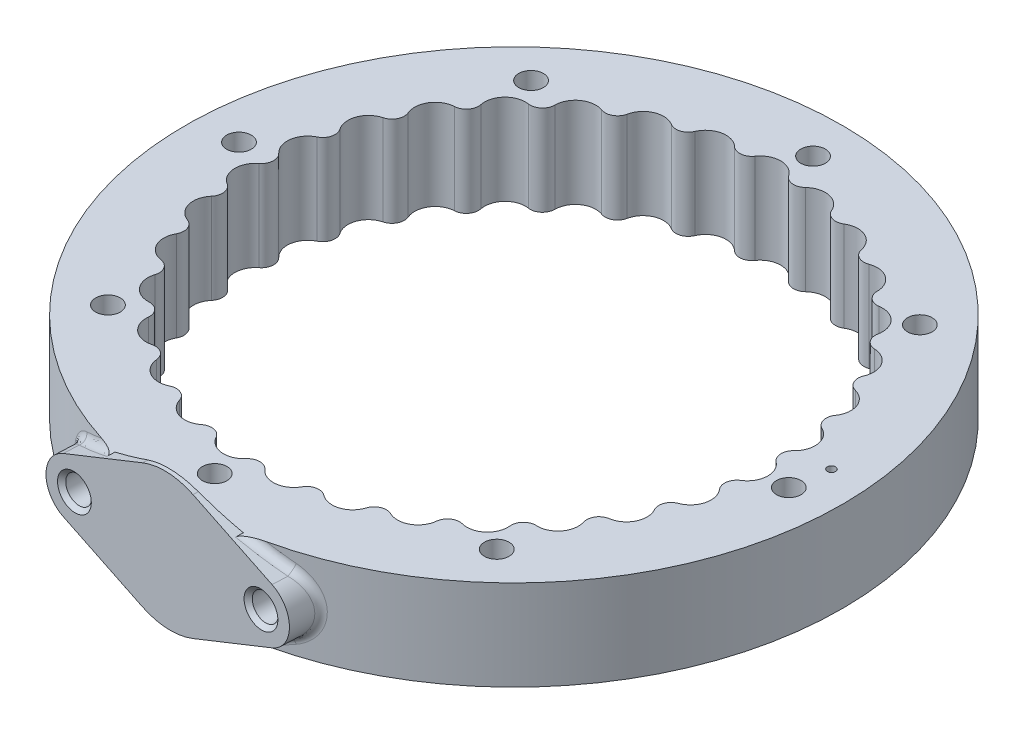
from build123d import *

# Parameters (mm, degrees)
SKETCH1_R                = 80
BOSS_EXTRUDE1_DEPTH      = 22
FILLET1_R                = 2.5
FILLET2_R                = 3
SKETCH3_R                = 3.000000000000008
SKETCH3_R_2              = 3.0000000000000084
SKETCH3_R_3              = 3.00000000000001
SKETCH3_R_4              = 3.0000000000000018
SKETCH3_R_5              = 3.000000000000013
CUT_EXTRUDE1_DEPTH       = 116.2562364317003
SKETCH5_R                = 0.9999999999999983
CUT_EXTRUDE3_DEPTH       = 2
BOSS_EXTRUDE2_REACH      = 184.594
BOSS_EXTRUDE2_END_RADIUS = 80
SKETCH7_R                = 3.300000000000001
CUT_EXTRUDE4_DEPTH       = 10.5
CHAMFER1_SIZE            = 1
FILLET3_R                = 2


with BuildPart() as part:
    # Sketch1 → Boss-Extrude1 (new body)
    with BuildSketch(Plane(origin=(0, 0, 0), x_dir=(1, 0, 0), z_dir=(0, 1, 0))):
        with Locations(Location((0, 0, 0), (0, 0, 270))):
            Circle(SKETCH1_R)
        with BuildLine():
            ThreePointArc((-38.25733201142191, 46.220953553208226), (-39.08234896333278, 45.52548736156793), (-39.894725747841804, 44.81529713729997))
            ThreePointArc((-39.894725747841804, 44.81529713729997), (-47.11153116989224, 44.78284973992021), (-46.77841172497277, 37.57366360216861))
            ThreePointArc((-46.77841172497277, 37.57366360216861), (-47.44654421626143, 36.726358952860394), (-48.09933135913986, 35.86717611972908))
            ThreePointArc((-48.09933135913986, 35.86717611972908), (-55.161876737158465, 34.38266067125329), (-53.38437776627331, 27.38810344853807))
            ThreePointArc((-53.38437776627331, 27.38810344853807), (-53.86827237424419, 26.423649093458668), (-54.33474469316336, 25.45064869760212))
            ThreePointArc((-54.33474469316336, 25.45064869760212), (-60.95388858956005, 22.574841434914035), (-57.80478110942453, 16.081271121758906))
            ThreePointArc((-57.80478110942453, 16.081271121758906), (-58.0846271319721, 15.039151935523844), (-58.345687195387306, 13.99216872747105))
            ThreePointArc((-58.345687195387306, 13.99216872747105), (-64.25044108132712, 9.842805537798224), (-59.85864992218248, 4.116069665785945))
            ThreePointArc((-59.85864992218248, 4.116069665785945), (-59.922990430263134, 3.038950130323448), (-59.96795040850489, 1.9608477256273142))
            ThreePointArc((-59.96795040850489, 1.9608477256273142), (-64.91657296611908, -3.292195974516327), (-59.46189857403357, -8.017644165922082))
            ThreePointArc((-59.46189857403357, -8.017644165922082), (-59.30809945968678, -9.085666650273934), (-59.1351186859633, -10.15075061249335))
            ThreePointArc((-59.1351186859633, -10.15075061249335), (-62.925012726303535, -16.29241459681624), (-56.63077011178724, -19.823114703444162))
            ThreePointArc((-56.63077011178724, -19.823114703444162), (-56.26512792882501, -20.838315170688706), (-55.881288256336916, -21.8467760278761))
            ThreePointArc((-55.881288256336916, -21.8467760278761), (-58.35729507209849, -28.625619851245656), (-51.481171267331455, -30.81702459588994))
            ThreePointArc((-51.481171267331455, -30.81702459588994), (-50.91865544968535, -31.73784061961726), (-50.3396713197235, -32.64839186579035))
            ThreePointArc((-50.3396713197235, -32.64839186579035), (-51.40042290095079, -39.786888865597625), (-44.223927222410275, -40.54928188053345))
            ThreePointArc((-44.223927222410275, -40.54928188053345), (-43.487567233747555, -41.33801514454081), (-42.73714232462038, -42.113378704695975))
            ThreePointArc((-42.73714232462038, -42.113378704695975), (-42.33921137694489, -49.31927797503106), (-35.15615040091281, -48.621446800649586))
            ThreePointArc((-35.15615040091281, -48.621446800649586), (-34.27609290568797, -49.245806472436286), (-33.384949701346294, -49.85423887131944))
            ThreePointArc((-33.384949701346294, -49.85423887131944), (-31.54462756452073, -56.83253004939758), (-24.649076651329672, -54.70304397596968))
            ThreePointArc((-24.649076651329672, -54.70304397596968), (-23.66135130679959, -55.13746869721361), (-22.66597331473413, -55.55406064092668))
            ThreePointArc((-22.66597331473413, -55.55406064092668), (-19.45860299326879, -62.01905166600311), (-13.132866807497502, -58.54509210357883))
            ThreePointArc((-13.132866807497502, -58.54509210357883), (-12.077911205320014, -58.77179647514957), (-11.019049317477785, -58.97949264056949))
            ThreePointArc((-11.019049317477785, -58.97949264056949), (-6.575940929183566, -64.66650602047315), (-1.0789958535201936, -59.99029728171117))
            ThreePointArc((-1.0789958535201936, -59.99029728171117), (-4.7594e-13, -59.99999999999997), (1.0789958535192405, -59.99029728171119))
            ThreePointArc((1.0789958535192405, -59.99029728171119), (6.575940929182646, -64.66650602047334), (11.019049317477018, -58.97949264056963))
            ThreePointArc((11.019049317477018, -58.97949264056963), (12.077911205319237, -58.77179647514973), (13.132866807496727, -58.545092103578995))
            ThreePointArc((13.132866807496727, -58.545092103578995), (19.458602993267856, -62.019051666003314), (22.665973314733233, -55.55406064092704))
            ThreePointArc((22.665973314733233, -55.55406064092704), (23.661351306798718, -55.137468697214), (24.6490766513288, -54.70304397597007))
            ThreePointArc((24.6490766513288, -54.70304397597007), (31.54462756451996, -56.832530049398116), (33.38494970134564, -49.854238871319865))
            ThreePointArc((33.38494970134564, -49.854238871319865), (34.27609290568728, -49.245806472436755), (35.1561504009121, -48.62144680065009))
            ThreePointArc((35.1561504009121, -48.62144680065009), (42.33921137694416, -49.31927797503165), (42.737142324619775, -42.113378704696586))
            ThreePointArc((42.737142324619775, -42.113378704696586), (43.48756723374697, -41.33801514454142), (44.223927222409706, -40.549281880534075))
            ThreePointArc((44.223927222409706, -40.549281880534075), (51.400422900950204, -39.78688886559833), (50.339671319723045, -32.64839186579106))
            ThreePointArc((50.339671319723045, -32.64839186579106), (50.918655449684906, -31.73784061961798), (51.481171267331014, -30.817024595890675))
            ThreePointArc((51.481171267331014, -30.817024595890675), (58.35729507209809, -28.625619851246487), (55.88128825633658, -21.846776027876892))
            ThreePointArc((55.88128825633658, -21.846776027876892), (56.26512792882472, -20.838315170689455), (56.63077011178698, -19.823114703444876))
            ThreePointArc((56.63077011178698, -19.823114703444876), (62.925012726303216, -16.292414596817103), (59.13511868596313, -10.15075061249427))
            ThreePointArc((59.13511868596313, -10.15075061249427), (59.30809945968664, -9.085666650274833), (59.46189857403344, -8.017644165922947))
            ThreePointArc((59.46189857403344, -8.017644165922947), (64.91657296611842, -3.2921959745165603), (59.9679504085049, 1.9608477256264434))
            ThreePointArc((59.9679504085049, 1.9608477256264434), (59.922990430263155, 3.0389501303225575), (59.85864992218252, 4.116069665785066))
            ThreePointArc((59.85864992218252, 4.116069665785066), (64.25044108132727, 9.842805537797286), (58.345687195387484, 13.992168727470187))
            ThreePointArc((58.345687195387484, 13.992168727470187), (58.0846271319723, 15.039151935523012), (57.80478110942474, 16.081271121758082))
            ThreePointArc((57.80478110942474, 16.081271121758082), (60.95388858956038, 22.57484143491317), (54.33474469316371, 25.45064869760134))
            ThreePointArc((54.33474469316371, 25.45064869760134), (53.86827237424453, 26.423649093457957), (53.38437776627365, 27.38810344853738))
            ThreePointArc((53.38437776627365, 27.38810344853738), (55.16187673715889, 34.38266067125244), (48.09933135914042, 35.86717611972831))
            ThreePointArc((48.09933135914042, 35.86717611972831), (47.446544216262005, 36.726358952859634), (46.778411724973346, 37.573663602167855))
            ThreePointArc((46.778411724973346, 37.573663602167855), (47.11153116989295, 44.78284973991959), (39.894725747842365, 44.81529713729946))
            ThreePointArc((39.894725747842365, 44.81529713729946), (39.08234896333339, 45.52548736156738), (38.25733201142257, 46.22095355320766))
            ThreePointArc((38.25733201142257, 46.22095355320766), (37.13243398116162, 53.34962367847298), (30.056825376996436, 51.92867462449567))
            ThreePointArc((30.056825376996436, 51.92867462449567), (29.118117751864872, 52.46079696867489), (28.16999263027844, 52.97595223504771))
            ThreePointArc((28.16999263027844, 52.97595223504771), (25.633130582365766, 59.73225775531498), (18.988395043689327, 56.916086071204795))
            ThreePointArc((18.988395043689327, 56.916086071204795), (17.961787378401546, 57.24835538400289), (16.929370441017248, 57.56210920797473))
            ThreePointArc((16.929370441017248, 57.56210920797473), (13.084403805762948, 63.66944618141221), (7.14257758625173, 59.573346266802666))
            ThreePointArc((7.14257758625173, 59.573346266802666), (6.070099319245904, 59.69215940351368), (4.9956578367840825, 59.79166666666665))
            ThreePointArc((4.9956578367840825, 59.79166666666665), (3.1e-16, 65), (-4.9956578367840825, 59.79166666666665))
            ThreePointArc((-4.9956578367840825, 59.79166666666665), (-6.070099319245474, 59.69215940351374), (-7.1425775862508685, 59.57334626680277))
            ThreePointArc((-7.1425775862508685, 59.57334626680277), (-13.08440380576203, 63.66944618141241), (-16.929370441016417, 57.56210920797498))
            ThreePointArc((-16.929370441016417, 57.56210920797498), (-17.96178737840073, 57.24835538400315), (-18.988395043688527, 56.91608607120505))
            ThreePointArc((-18.988395043688527, 56.91608607120505), (-25.633130582364917, 59.73225775531533), (-28.169992630277697, 52.975952235048105))
            ThreePointArc((-28.169992630277697, 52.975952235048105), (-29.118117751864123, 52.46079696867532), (-30.056825376995683, 51.928674624496125))
            ThreePointArc((-30.056825376995683, 51.928674624496125), (-37.132433981160844, 53.349623678473534), (-38.25733201142191, 46.220953553208226))
        make_face(mode=Mode.SUBTRACT)
    extrude(amount=BOSS_EXTRUDE1_DEPTH)

    # Fillet1
    # the kernel refuses this fillet: 2.5 mm, written as the material it takes off along each edge
    with BuildSketch(Plane(origin=(44.2239272224097, -4.826317104519436, 40.549281880534075), x_dir=(0.8583145747701298, 0, 0.5131238551628362), z_dir=(0, 1, 0))) as fillet1_piece_1:
        with BuildLine():
            CenterArc((2.0109654602164038, -2.46743606132209), FILLET1_R, 99.25781783821463, 67.25275199155593)
            ThreePointArc((-0.42006696343993455, -1.8842711145603852), (-0.20245458304721137, -0.9438251469189064), (0, 0))
            ThreePointArc((0, 0), (0.8043861840865579, -0.06512787735582339), (1.6087723681731287, -5e-17))
        make_face()
    extrude(amount=31.652634209038876, mode=Mode.SUBTRACT)
    with BuildSketch(Plane(origin=(42.73714232461978, -4.8263171045193936, 42.113378704696586), x_dir=(0.6903397538566601, 0, -0.7234853310504131), z_dir=(0, 1, 0))) as fillet1_piece_2:
        with BuildLine():
            CenterArc((1.9707461510120805, -2.4996764604978607), FILLET1_R, 90.92179843437304, 67.25275199155573)
            ThreePointArc((-0.3500558028666056, -1.570225928800313), (-0.11146049827858727, -0.7992842616251828), (0, 0))
            ThreePointArc((0, 0), (0.9652634209038754, -0.00776494805127867), (1.9305268418077572, 5e-17))
        make_face()
    extrude(amount=31.652634209038787, mode=Mode.SUBTRACT)
    with BuildSketch(Plane(origin=(35.15615040091211, -4.826317104519335, 48.6214468006501), x_dir=(0.7374537523342743, 0, 0.6753976333746652), z_dir=(0, 1, 0))) as fillet1_piece_3:
        with BuildLine():
            CenterArc((2.010965460216402, -2.4674360613220867), FILLET1_R, 99.25781783821479, 67.2527519915552)
            ThreePointArc((-0.420066963439932, -1.8842711145603563), (-0.20245458304721417, -0.9438251469188901), (0, 0))
            ThreePointArc((0, 0), (0.8043861840865599, -0.06512787735581876), (1.6087723681731199, 3e-17))
        make_face()
    extrude(amount=31.652634209038673, mode=Mode.SUBTRACT)
    with BuildSketch(Plane(origin=(33.38494970134565, -4.82631710451927, 49.854238871319865), x_dir=(0.8218449849857772, 0, -0.5697111730111387), z_dir=(0, 1, 0))) as fillet1_piece_4:
        with BuildLine():
            CenterArc((1.970746151012077, -2.499676460497867), FILLET1_R, 90.92179843437401, 67.25275199155462)
            ThreePointArc((-0.35005580286661114, -1.570225928800312), (-0.11146049827858301, -0.7992842616251806), (0, 0))
            ThreePointArc((0, 0), (0.965263420903851, -0.00776494805127588), (1.930526841807712, 4e-17))
        make_face()
    extrude(amount=31.652634209038542, mode=Mode.SUBTRACT)
    with BuildSketch(Plane(origin=(24.649076651328798, -4.826317104519279, 54.70304397597006), x_dir=(0.5864014866307153, 0, 0.8100205531202817), z_dir=(0, 1, 0))) as fillet1_piece_5:
        with BuildLine():
            CenterArc((2.010965460216424, -2.467436061322089), FILLET1_R, 99.25781783821469, 67.25275199155462)
            ThreePointArc((-0.42006696343990574, -1.8842711145603286), (-0.20245458304718897, -0.9438251469188804), (0, 0))
            ThreePointArc((0, 0), (0.8043861840865777, -0.06512787735582257), (1.6087723681731465, -1.3e-16))
        make_face()
    extrude(amount=31.652634209038563, mode=Mode.SUBTRACT)
    with BuildSketch(Plane(origin=(22.665973314733233, -4.826317104519319, 55.55406064092704), x_dir=(0.9197037858668944, 0, -0.39261297261056183), z_dir=(0, 1, 0))) as fillet1_piece_6:
        with BuildLine():
            CenterArc((1.9707461510120927, -2.4996764604978647), FILLET1_R, 90.92179843437401, 67.2527519915547)
            ThreePointArc((-0.3500558028665968, -1.5702259288003135), (-0.11146049827857614, -0.7992842616251827), (0, 0))
            ThreePointArc((0, 0), (0.9652634209038673, -0.00776494805127705), (1.9305268418077277, 6e-17))
        make_face()
    extrude(amount=31.652634209038638, mode=Mode.SUBTRACT)
    with BuildSketch(Plane(origin=(13.132866807496725, -4.826317104519466, 58.545092103578995), x_dir=(0.41134187516525045, 0, 0.9114811362477753), z_dir=(0, 1, 0))) as fillet1_piece_7:
        with BuildLine():
            CenterArc((2.0109654602164477, -2.467436061322087), FILLET1_R, 99.25781783821506, 67.25275199155612)
            ThreePointArc((-0.4200669634398975, -1.8842711145604085), (-0.2024545830472022, -0.9438251469189162), (0, 0))
            ThreePointArc((0, 0), (0.8043861840865818, -0.06512787735582286), (1.6087723681731538, 6e-17))
        make_face()
    extrude(amount=31.652634209038936, mode=Mode.SUBTRACT)
    with BuildSketch(Plane(origin=(11.01904931747702, -4.82631710451942, 58.97949264056964), x_dir=(0.979909805694009, 0, -0.19944115098125995), z_dir=(0, 1, 0))) as fillet1_piece_8:
        with BuildLine():
            CenterArc((1.970746151012078, -2.4996764604978647), FILLET1_R, 90.92179843437276, 67.25275199155587)
            ThreePointArc((-0.350055802866609, -1.5702259288003093), (-0.11146049827858164, -0.7992842616251682), (0, 0))
            ThreePointArc((0, 0), (0.9652634209038875, -0.00776494805127172), (1.930526841807768, 0))
        make_face()
    extrude(amount=31.652634209038837, mode=Mode.SUBTRACT)
    with BuildSketch(Plane(origin=(1.078995853519241, -4.826317104519429, 59.990297281711186), x_dir=(0.21944187899989498, 0, 0.9756255745628009), z_dir=(0, 1, 0))) as fillet1_piece_9:
        with BuildLine():
            CenterArc((2.0109654602164224, -2.46743606132209), FILLET1_R, 99.25781783821463, 67.25275199155604)
            ThreePointArc((-0.42006696343991906, -1.8842711145603892), (-0.2024545830472047, -0.9438251469189057), (0, 0))
            ThreePointArc((0, 0), (0.8043861840865677, -0.06512787735582141), (1.6087723681731474, 2e-17))
        make_face()
    extrude(amount=31.652634209038858, mode=Mode.SUBTRACT)
    with BuildSketch(Plane(origin=(-1.078995853520195, -4.826317104519406, 59.990297281711165), x_dir=(0.9999982029415024, 0, 0.00189581480257711), z_dir=(0, 1, 0))) as fillet1_piece_10:
        with BuildLine():
            CenterArc((1.9707461510121, -2.4996764604978634), FILLET1_R, 90.92179843437337, 67.2527519915554)
            ThreePointArc((-0.3500558028665901, -1.5702259288003146), (-0.1114604982785759, -0.7992842616251862), (0, 0))
            ThreePointArc((0, 0), (0.9652634209038817, -0.00776494805128667), (1.9305268418077632, 0))
        make_face()
    extrude(amount=31.652634209038816, mode=Mode.SUBTRACT)
    with BuildSketch(Plane(origin=(-11.019049317477787, -4.826317104519367, 58.9794926405695), x_dir=(0.018557906524971083, 0, 0.9998277872240852), z_dir=(0, 1, 0))) as fillet1_piece_11:
        with BuildLine():
            CenterArc((2.0109654602164073, -2.467436061322091), FILLET1_R, 99.25781783821469, 67.25275199155536)
            ThreePointArc((-0.4200669634399306, -1.8842711145603632), (-0.20245458304722214, -0.943825146918889), (0, 0))
            ThreePointArc((0, 0), (0.80438618408656, -0.0651278773558238), (1.6087723681731294, 0))
        make_face()
    extrude(amount=31.652634209038737, mode=Mode.SUBTRACT)
    with BuildSketch(Plane(origin=(-13.132866807497498, -4.826317104519399, 58.54509210357883), x_dir=(0.9791465562657697, 0, 0.20315516570563444), z_dir=(0, 1, 0))) as fillet1_piece_12:
        with BuildLine():
            CenterArc((1.9707461510120767, -2.4996764604978634), FILLET1_R, 90.92179843437296, 67.25275199155598)
            ThreePointArc((-0.3500558028666137, -1.570225928800322), (-0.11146049827858176, -0.7992842616251794), (0, 0))
            ThreePointArc((0, 0), (0.96526342090388, -0.00776494805128287), (1.9305268418077577, 3e-17))
        make_face()
    extrude(amount=31.652634209038794, mode=Mode.SUBTRACT)
    with BuildSketch(Plane(origin=(-22.665973314734135, -4.8263171045195055, 55.554060640926686), x_dir=(-0.18308582882355504, 0, 0.9830969328016398), z_dir=(0, 1, 0))) as fillet1_piece_13:
        with BuildLine():
            CenterArc((2.0109654602164158, -2.4674360613220876), FILLET1_R, 99.25781783821475, 67.25275199155675)
            ThreePointArc((-0.4200669634399335, -1.884271114560421), (-0.2024545830472302, -0.9438251469189181), (0, 0))
            ThreePointArc((0, 0), (0.804386184086569, -0.06512787735582048), (1.6087723681731356, -2e-17))
        make_face()
    extrude(amount=31.652634209039014, mode=Mode.SUBTRACT)
    with BuildSketch(Plane(origin=(-24.64907665132968, -4.82631710451945, 54.703043975969685), x_dir=(0.9182085345316807, 0, 0.3960973202549891), z_dir=(0, 1, 0))) as fillet1_piece_14:
        with BuildLine():
            CenterArc((1.9707461510120736, -2.4996764604978647), FILLET1_R, 90.9217984343722, 67.25275199155631)
            ThreePointArc((-0.3500558028666108, -1.5702259288003053), (-0.11146049827858172, -0.7992842616251772), (0, 0))
            ThreePointArc((0, 0), (0.965263420903897, -0.00776494805126599), (1.9305268418077872, -2e-17))
        make_face()
    extrude(amount=31.652634209038897, mode=Mode.SUBTRACT)
    with BuildSketch(Plane(origin=(-33.3849497013463, -4.826317104519394, 49.854238871319446), x_dir=(-0.3772340088283667, 0, 0.9261179744413127), z_dir=(0, 1, 0))) as fillet1_piece_15:
        with BuildLine():
            CenterArc((2.0109654602163967, -2.4674360613220907), FILLET1_R, 99.25781783821469, 67.25275199155564)
            ThreePointArc((-0.4200669634399429, -1.8842711145603752), (-0.20245458304723304, -0.9438251469188845), (0, 0))
            ThreePointArc((0, 0), (0.8043861840865462, -0.06512787735581972), (1.6087723681731187, -3e-17))
        make_face()
    extrude(amount=31.652634209038787, mode=Mode.SUBTRACT)
    with BuildSketch(Plane(origin=(-35.15615040091281, -4.826317104519455, 48.62144680064959), x_dir=(0.8196789475089408, 0, 0.5728232039736476), z_dir=(0, 1, 0))) as fillet1_piece_16:
        with BuildLine():
            CenterArc((1.9707461510121058, -2.4996764604978607), FILLET1_R, 90.92179843437262, 67.25275199155635)
            ThreePointArc((-0.3500558028665887, -1.5702259288003195), (-0.11146049827858306, -0.7992842616251851), (0, 0))
            ThreePointArc((0, 0), (0.9652634209038926, -0.00776494805126576), (1.9305268418078017, 1e-17))
        make_face()
    extrude(amount=31.65263420903891, mode=Mode.SUBTRACT)
    with BuildSketch(Plane(origin=(-42.73714232462038, -4.826317104519408, 42.113378704695975), x_dir=(-0.5559381841886414, 0, 0.8312236373931122), z_dir=(0, 1, 0))) as fillet1_piece_17:
        with BuildLine():
            CenterArc((2.0109654602164175, -2.467436061322091), FILLET1_R, 99.25781783821462, 67.25275199155583)
            ThreePointArc((-0.42006696343991956, -1.884271114560381), (-0.20245458304721525, -0.9438251469188929), (0, 0))
            ThreePointArc((0, 0), (0.8043861840865753, -0.06512787735582352), (1.6087723681731425, 7e-17))
        make_face()
    extrude(amount=31.652634209038816, mode=Mode.SUBTRACT)
    with BuildSketch(Plane(origin=(-44.22392722241028, -4.826317104519377, 40.54928188053344), x_dir=(0.6875916080669998, 0, 0.7260976384177525), z_dir=(0, 1, 0))) as fillet1_piece_18:
        with BuildLine():
            CenterArc((1.9707461510120945, -2.4996764604978616), FILLET1_R, 90.9217984343733, 67.25275199155541)
            ThreePointArc((-0.3500558028665927, -1.5702259288003118), (-0.11146049827857123, -0.7992842616251852), (0, 0))
            ThreePointArc((0, 0), (0.965263420903888, -0.00776494805127452), (1.9305268418077606, -1.1e-16))
        make_face()
    extrude(amount=31.652634209038755, mode=Mode.SUBTRACT)
    with BuildSketch(Plane(origin=(-50.33967131972351, -4.826317104519307, 32.64839186579036), x_dir=(-0.7118821849682658, 0, 0.7022989069654088), z_dir=(0, 1, 0))) as fillet1_piece_19:
        with BuildLine():
            CenterArc((2.010965460216426, -2.4674360613220903), FILLET1_R, 99.25781783821485, 67.25275199155492)
            ThreePointArc((-0.4200669634399033, -1.8842711145603515), (-0.20245458304720335, -0.9438251469188889), (0, 0))
            ThreePointArc((0, 0), (0.8043861840865615, -0.0651278773558212), (1.6087723681731414, 5e-17))
        make_face()
    extrude(amount=31.652634209038613, mode=Mode.SUBTRACT)
    with BuildSketch(Plane(origin=(-51.481171267331455, -4.826317104519265, 30.81702459588994), x_dir=(0.5273541874022095, 0, 0.8496455502321867), z_dir=(0, 1, 0))) as fillet1_piece_20:
        with BuildLine():
            CenterArc((1.9707461510120854, -2.4996764604978634), FILLET1_R, 90.92179843437434, 67.25275199155432)
            ThreePointArc((-0.35005580286660065, -1.57022592880031), (-0.11146049827858133, -0.7992842616251795), (0, 0))
            ThreePointArc((0, 0), (0.965263420903855, -0.00776494805128479), (1.930526841807706, 7e-17))
        make_face()
    extrude(amount=31.652634209038528, mode=Mode.SUBTRACT)
    with BuildSketch(Plane(origin=(-55.881288256336916, -4.8263171045193936, 21.8467760278761), x_dir=(-0.8386816454526804, 0, 0.5446219767699283), z_dir=(0, 1, 0))) as fillet1_piece_21:
        with BuildLine():
            CenterArc((2.01096546021641, -2.46743606132209), FILLET1_R, 99.25781783821478, 67.25275199155553)
            ThreePointArc((-0.42006696343992694, -1.8842711145603734), (-0.20245458304722505, -0.9438251469188962), (0, 0))
            ThreePointArc((0, 0), (0.8043861840865669, -0.06512787735582364), (1.6087723681731285, 5e-17))
        make_face()
    extrude(amount=31.652634209038787, mode=Mode.SUBTRACT)
    with BuildSketch(Plane(origin=(-56.63077011178724, -4.826317104519426, 19.823114703444162), x_dir=(0.3455268243436886, 0, 0.938408873391), z_dir=(0, 1, 0))) as fillet1_piece_22:
        with BuildLine():
            CenterArc((1.9707461510120992, -2.499676460497863), FILLET1_R, 90.92179843437317, 67.25275199155574)
            ThreePointArc((-0.35005580286659116, -1.5702259288003204), (-0.11146049827857828, -0.7992842616251827), (0, 0))
            ThreePointArc((0, 0), (0.965263420903887, -0.00776494805127115), (1.9305268418077706, 4e-17))
        make_face()
    extrude(amount=31.652634209038855, mode=Mode.SUBTRACT)
    with BuildSketch(Plane(origin=(-59.13511868596331, -4.826317104519396, 10.150750612493352), x_dir=(-0.9311453808313587, 0, 0.3646481588551134), z_dir=(0, 1, 0))) as fillet1_piece_23:
        with BuildLine():
            CenterArc((2.010965460216401, -2.4674360613220894), FILLET1_R, 99.25781783821462, 67.25275199155568)
            ThreePointArc((-0.42006696343993655, -1.8842711145603732), (-0.20245458304722486, -0.9438251469188953), (0, 0))
            ThreePointArc((0, 0), (0.8043861840865587, -0.0651278773558197), (1.6087723681731267, -3e-17))
        make_face()
    extrude(amount=31.652634209038794, mode=Mode.SUBTRACT)
    with BuildSketch(Plane(origin=(-59.46189857403358, -4.826317104519938, 8.017644165922084), x_dir=(0.14955355249886146, 0, 0.9887536270148243), z_dir=(0, 1, 0))) as fillet1_piece_24:
        with BuildLine():
            CenterArc((1.9707461510122835, -2.49967646049786), FILLET1_R, 90.9217984343726, 67.252751991561)
            ThreePointArc((-0.3500558028664841, -1.5702259288005072), (-0.11146049827850507, -0.799284261625278), (0, 0))
            ThreePointArc((0, 0), (0.9652634209039882, -0.00776494805126829), (1.9305268418079797, 0))
        make_face()
    extrude(amount=31.652634209039874, mode=Mode.SUBTRACT)
    with BuildSketch(Plane(origin=(-59.96795040850488, -4.826317104519914, -1.960847725627314), x_dir=(-0.9854879149138797, 0, 0.16974560247232914), z_dir=(0, 1, 0))) as fillet1_piece_25:
        with BuildLine():
            CenterArc((2.0109654602166342, -2.467436061322082), FILLET1_R, 99.25781783821587, 67.25275199156049)
            ThreePointArc((-0.4200669634397641, -1.8842711145606228), (-0.20245458304712435, -0.9438251469190214), (0, 0))
            ThreePointArc((0, 0), (0.8043861840866564, -0.06512787735583489), (1.6087723681733053, -2e-17))
        make_face()
    extrude(amount=31.65263420903983, mode=Mode.SUBTRACT)
    with BuildSketch(Plane(origin=(-59.85864992218248, -4.826317104519404, -4.1160696657859415), x_dir=(-0.052542459357068465, 0, 0.9986186909750441), z_dir=(0, 1, 0))) as fillet1_piece_26:
        with BuildLine():
            CenterArc((1.970746151012077, -2.499676460497864), FILLET1_R, 90.92179843437292, 67.25275199155546)
            ThreePointArc((-0.3500558028666056, -1.5702259288002984), (-0.11146049827858191, -0.7992842616251726), (0, 0))
            ThreePointArc((0, 0), (0.9652634209038801, -0.00776494805127698), (1.9305268418077597, 1e-17))
        make_face()
    extrude(amount=31.65263420903881, mode=Mode.SUBTRACT)
    with BuildSketch(Plane(origin=(-58.34568719538731, -4.826317104519408, -13.992168727471046), x_dir=(-0.9994844579698772, 0, -0.03210635881972098), z_dir=(0, 1, 0))) as fillet1_piece_27:
        with BuildLine():
            CenterArc((2.010965460216394, -2.4674360613220885), FILLET1_R, 99.25781783821468, 67.25275199155583)
            ThreePointArc((-0.420066963439946, -1.8842711145603803), (-0.2024545830472287, -0.9438251469189004), (0, 0))
            ThreePointArc((0, 0), (0.8043861840865572, -0.06512787735582196), (1.6087723681731165, 0))
        make_face()
    extrude(amount=31.652634209038816, mode=Mode.SUBTRACT)
    with BuildSketch(Plane(origin=(-57.80478110942454, -4.826317104519435, -16.08127112175891), x_dir=(-0.2524873767534468, 0, 0.9676001883940304), z_dir=(0, 1, 0))) as fillet1_piece_28:
        with BuildLine():
            CenterArc((1.9707461510120838, -2.499676460497862), FILLET1_R, 90.92179843437282, 67.2527519915561)
            ThreePointArc((-0.35005580286660487, -1.57022592880032), (-0.11146049827857808, -0.7992842616251875), (0, 0))
            ThreePointArc((0, 0), (0.965263420903886, -0.00776494805126736), (1.930526841807771, 0))
        make_face()
    extrude(amount=31.652634209038876, mode=Mode.SUBTRACT)
    with BuildSketch(Plane(origin=(-54.334744693163366, -4.826317104519377, -25.45064869760212), x_dir=(-0.9725619898821684, 0, -0.23264388200947156), z_dir=(0, 1, 0))) as fillet1_piece_29:
        with BuildLine():
            CenterArc((2.01096546021639, -2.467436061322091), FILLET1_R, 99.25781783821456, 67.25275199155551)
            ThreePointArc((-0.4200669634399434, -1.8842711145603661), (-0.2024545830472202, -0.943825146918892), (0, 0))
            ThreePointArc((0, 0), (0.804386184086562, -0.0651278773558195), (1.6087723681731176, -4e-17))
        make_face()
    extrude(amount=31.652634209038755, mode=Mode.SUBTRACT)
    with BuildSketch(Plane(origin=(-53.38437776627331, -4.826317104519483, -27.388103448538075), x_dir=(-0.44209543127952433, 0, 0.8969680204119718), z_dir=(0, 1, 0))) as fillet1_piece_30:
        with BuildLine():
            CenterArc((1.9707461510120852, -2.4996764604978616), FILLET1_R, 90.92179843437248, 67.25275199155652)
            ThreePointArc((-0.35005580286660853, -1.5702259288003213), (-0.11146049827857947, -0.7992842616251911), (0, 0))
            ThreePointArc((0, 0), (0.9652634209038928, -0.00776494805127501), (1.9305268418077872, 4e-17))
        make_face()
    extrude(amount=31.652634209038965, mode=Mode.SUBTRACT)
    with BuildSketch(Plane(origin=(50.33967131972304, -4.826317104519245, 32.648391865791055), x_dir=(0.530571932093178, 0, -0.8476399146305653), z_dir=(0, 1, 0))) as fillet1_piece_31:
        with BuildLine():
            CenterArc((1.970746151012086, -2.4996764604978647), FILLET1_R, 90.92179843437454, 67.25275199155426)
            ThreePointArc((-0.350055802866603, -1.570225928800317), (-0.11146049827857711, -0.7992842616251815), (0, 0))
            ThreePointArc((0, 0), (0.9652634209038466, -0.00776494805129367), (1.9305268418076977, 1e-16))
        make_face()
    extrude(amount=31.652634209038485, mode=Mode.SUBTRACT)
    with BuildSketch(Plane(origin=(51.48117126733101, -4.826317104519216, 30.817024595890672), x_dir=(-0.5273541874022231, 0, 0.8496455502321782), z_dir=(0, 1, 0))) as fillet1_piece_32:
        with BuildLine():
            CenterArc((1.9707461510120483, 2.4996764604978634), FILLET1_R, 201.82544957407129, 67.2527519915547)
            ThreePointArc((-0.3500558028666391, 1.5702259288003126), (-0.11146049827857898, 0.7992842616251872), (0, 0))
            ThreePointArc((0, 0), (0.9652634209038428, 0.00776494805129273), (1.9305268418076833, -3e-17))
        make_face()
    extrude(amount=31.65263420903843, mode=Mode.SUBTRACT)
    with BuildSketch(Plane(origin=(55.88128825633659, -4.826317104519339, 21.846776027876896), x_dir=(0.34908243309023584, 0, -0.9370920205122872), z_dir=(0, 1, 0))) as fillet1_piece_33:
        with BuildLine():
            CenterArc((1.970746151012083, -2.499676460497865), FILLET1_R, 90.92179843437367, 67.2527519915553)
            ThreePointArc((-0.35005580286661203, -1.5702259288003233), (-0.11146049827857607, -0.7992842616251871), (0, 0))
            ThreePointArc((0, 0), (0.9652634209038661, -0.00776494805127525), (1.9305268418077324, 3e-17))
        make_face()
    extrude(amount=31.65263420903868, mode=Mode.SUBTRACT)
    with BuildSketch(Plane(origin=(56.63077011178699, -4.826317104519301, 19.82311470344488), x_dir=(0.9911082799942895, 0, 0.1330577969408817), z_dir=(0, 1, 0))) as fillet1_piece_34:
        with BuildLine():
            CenterArc((2.0109654602164038, -2.4674360613220903), FILLET1_R, 99.25781783821475, 67.25275199155462)
            ThreePointArc((-0.4200669634399225, -1.884271114560335), (-0.20245458304721098, -0.9438251469188779), (0, 0))
            ThreePointArc((0, 0), (0.8043861840865616, -0.06512787735582368), (1.6087723681731234, -1e-17))
        make_face()
    extrude(amount=31.652634209038602, mode=Mode.SUBTRACT)
    with BuildSketch(Plane(origin=(59.13511868596313, -4.826317104519405, 10.15075061249427), x_dir=(0.15330145826113978, 0, -0.9881794689705955), z_dir=(0, 1, 0))) as fillet1_piece_35:
        with BuildLine():
            CenterArc((1.9707461510120883, -2.4996764604978634), FILLET1_R, 90.92179843437304, 67.25275199155561)
            ThreePointArc((-0.35005580286660043, -1.5702259288003093), (-0.11146049827858036, -0.7992842616251782), (0, 0))
            ThreePointArc((0, 0), (0.9652634209038817, -0.00776494805127167), (1.9305268418077657, 5e-17))
        make_face()
    extrude(amount=31.65263420903881, mode=Mode.SUBTRACT)
    with BuildSketch(Plane(origin=(59.46189857403344, -4.826317104519344, 8.017644165922947), x_dir=(0.9976045728881241, 0, -0.06917453398978149), z_dir=(0, 1, 0))) as fillet1_piece_36:
        with BuildLine():
            CenterArc((2.010965460216418, -2.467436061322089), FILLET1_R, 99.25781783821482, 67.25275199155506)
            ThreePointArc((-0.42006696343991556, -1.8842711145603541), (-0.20245458304721356, -0.9438251469188857), (0, 0))
            ThreePointArc((0, 0), (0.8043861840865645, -0.06512787735582208), (1.6087723681731347, -2e-17))
        make_face()
    extrude(amount=31.652634209038688, mode=Mode.SUBTRACT)
    with BuildSketch(Plane(origin=(59.96795040850489, -4.826317104519444, -1.9608477256264458), x_dir=(-0.04875569628132711, 0, -0.9988107338630893), z_dir=(0, 1, 0))) as fillet1_piece_37:
        with BuildLine():
            CenterArc((1.9707461510120774, -2.499676460497866), FILLET1_R, 90.92179843437256, 67.25275199155635)
            ThreePointArc((-0.35005580286661425, -1.5702259288003235), (-0.1114604982785831, -0.7992842616251894), (0, 0))
            ThreePointArc((0, 0), (0.965263420903888, -0.00776494805128564), (1.930526841807776, 0))
        make_face()
    extrude(amount=31.652634209038887, mode=Mode.SUBTRACT)
    with BuildSketch(Plane(origin=(59.85864992218252, -4.826317104519483, -4.116069665785066), x_dir=(0.9632588173543589, 0, -0.26857485137123666), z_dir=(0, 1, 0))) as fillet1_piece_38:
        with BuildLine():
            CenterArc((2.010965460216394, -2.46743606132209), FILLET1_R, 99.25781783821463, 67.25275199155641)
            ThreePointArc((-0.420066963439951, -1.8842711145604052), (-0.2024545830472265, -0.943825146918912), (0, 0))
            ThreePointArc((0, 0), (0.804386184086569, -0.06512787735582151), (1.6087723681731187, -2e-17))
        make_face()
    extrude(amount=31.652634209038965, mode=Mode.SUBTRACT)
    with BuildSketch(Plane(origin=(58.34568719538747, -4.826317104519217, -13.992168727470185), x_dir=(-0.24881678688947426, 0, -0.9685505699559512), z_dir=(0, 1, 0))) as fillet1_piece_39:
        with BuildLine():
            CenterArc((1.9707461510120985, -2.499676460497863), FILLET1_R, 90.92179843437499, 67.25275199155395)
            ThreePointArc((-0.35005580286659305, -1.570225928800321), (-0.11146049827857582, -0.7992842616251947), (0, 0))
            ThreePointArc((0, 0), (0.9652634209038462, -0.00776494805128336), (1.9305268418076904, 2e-17))
        make_face()
    extrude(amount=31.652634209038435, mode=Mode.SUBTRACT)
    with BuildSketch(Plane(origin=(57.80478110942473, -4.826317104519236, -16.081271121758082), x_dir=(0.8894771326600027, 0, -0.4569796827813463), z_dir=(0, 1, 0))) as fillet1_piece_40:
        with BuildLine():
            CenterArc((2.010965460216435, -2.467436061322089), FILLET1_R, 99.25781783821478, 67.2527519915543)
            ThreePointArc((-0.4200669634398863, -1.8842711145603204), (-0.20245458304719252, -0.9438251469188695), (0, 0))
            ThreePointArc((0, 0), (0.80438618408658, -0.06512787735582302), (1.608772368173153, 0))
        make_face()
    extrude(amount=31.652634209038474, mode=Mode.SUBTRACT)
    with BuildSketch(Plane(origin=(54.334744693163714, -4.826317104519441, -25.450648697601352), x_dir=(-0.43869128900765114, 0, -0.898637831914952), z_dir=(0, 1, 0))) as fillet1_piece_41:
        with BuildLine():
            CenterArc((1.9707461510120727, -2.499676460497864), FILLET1_R, 90.92179843437258, 67.25275199155611)
            ThreePointArc((-0.3500558028666136, -1.570225928800312), (-0.11146049827858932, -0.7992842616251868), (0, 0))
            ThreePointArc((0, 0), (0.9652634209038918, -0.00776494805125946), (1.93052684180777, -1.2e-16))
        make_face()
    extrude(amount=31.65263420903888, mode=Mode.SUBTRACT)
    with BuildSketch(Plane(origin=(53.38437776627366, -4.826317104519516, -27.388103448537386), x_dir=(0.779280149645415, 0, -0.6266757122855644), z_dir=(0, 1, 0))) as fillet1_piece_42:
        with BuildLine():
            CenterArc((2.0109654602164033, -2.4674360613220885), FILLET1_R, 99.25781783821473, 67.2527519915567)
            ThreePointArc((-0.4200669634399447, -1.88427111456042), (-0.20245458304722894, -0.9438251469189173), (0, 0))
            ThreePointArc((0, 0), (0.8043861840865687, -0.06512787735582287), (1.6087723681731236, 8e-17))
        make_face()
    extrude(amount=31.652634209039036, mode=Mode.SUBTRACT)
    with BuildSketch(Plane(origin=(48.09933135914043, -4.826317104519421, -35.86717611972832), x_dir=(-0.6106057182098095, 0, -0.7919347554498937), z_dir=(0, 1, 0))) as fillet1_piece_43:
        with BuildLine():
            CenterArc((1.9707461510120738, -2.4996764604978647), FILLET1_R, 90.92179843437256, 67.25275199155578)
            ThreePointArc((-0.35005580286660953, -1.5702259288002984), (-0.11146049827858524, -0.7992842616251825), (0, 0))
            ThreePointArc((0, 0), (0.965263420903888, -0.00776494805127106), (1.930526841807772, -1e-17))
        make_face()
    extrude(amount=31.65263420903884, mode=Mode.SUBTRACT)
    with BuildSketch(Plane(origin=(46.77841172497335, -4.826317104519418, -37.57366360216786), x_dir=(0.6371793457428188, 0, -0.7707155644975346), z_dir=(0, 1, 0))) as fillet1_piece_44:
        with BuildLine():
            CenterArc((2.010965460216421, -2.4674360613220885), FILLET1_R, 99.25781783821476, 67.252751991556)
            ThreePointArc((-0.42006696343991806, -1.8842711145603916), (-0.20245458304721262, -0.943825146918902), (0, 0))
            ThreePointArc((0, 0), (0.8043861840865661, -0.0651278773558246), (1.6087723681731407, -5e-17))
        make_face()
    extrude(amount=31.652634209038837, mode=Mode.SUBTRACT)
    with BuildSketch(Plane(origin=(38.25733201142258, -4.826317104519415, -46.220953553207664), x_dir=(0.4689923445601163, 0, -0.8832022309437433), z_dir=(0, 1, 0))) as fillet1_piece_45:
        with BuildLine():
            CenterArc((2.0109654602164144, -2.467436061322087), FILLET1_R, 99.25781783821476, 67.25275199155594)
            ThreePointArc((-0.4200669634399254, -1.8842711145603879), (-0.20245458304721078, -0.9438251469189061), (0, 0))
            ThreePointArc((0, 0), (0.804386184086568, -0.06512787735582133), (1.608772368173134, -7e-17))
        make_face()
    extrude(amount=31.65263420903883, mode=Mode.SUBTRACT)
    with BuildSketch(Plane(origin=(39.89472574784237, -4.826317104519371, -44.815297137299474), x_dir=(-0.7575218775653302, 0, -0.6528097770483351), z_dir=(0, 1, 0))) as fillet1_piece_46:
        with BuildLine():
            CenterArc((1.9707461510120758, -2.499676460497862), FILLET1_R, 90.92179843437326, 67.25275199155543)
            ThreePointArc((-0.35005580286661625, -1.5702259288003089), (-0.11146049827858664, -0.7992842616251763), (0, 0))
            ThreePointArc((0, 0), (0.9652634209038691, -0.00776494805128735), (1.930526841807744, 6e-17))
        make_face()
    extrude(amount=31.65263420903874, mode=Mode.SUBTRACT)
    with BuildSketch(Plane(origin=(30.056825376996436, -4.826317104519465, -51.92867462449567), x_dir=(-0.8734250022482813, 0, -0.4869586896725323), z_dir=(0, 1, 0))) as fillet1_piece_47:
        with BuildLine():
            CenterArc((1.9707461510121054, -2.499676460497866), FILLET1_R, 90.92179843437292, 67.25275199155608)
            ThreePointArc((-0.35005580286658655, -1.5702259288003269), (-0.11146049827857556, -0.7992842616251901), (0, 0))
            ThreePointArc((0, 0), (0.9652634209039002, -0.00776494805126864), (1.9305268418077886, -5e-17))
        make_face()
    extrude(amount=31.652634209038933, mode=Mode.SUBTRACT)
    with BuildSketch(Plane(origin=(28.169992630278443, -4.826317104519411, -52.975952235047714), x_dir=(0.28160474168686117, 0, -0.9595304942832595), z_dir=(0, 1, 0))) as fillet1_piece_48:
        with BuildLine():
            CenterArc((2.010965460216404, -2.46743606132209), FILLET1_R, 99.25781783821468, 67.25275199155577)
            ThreePointArc((-0.4200669634399365, -1.884271114560379), (-0.20245458304722244, -0.9438251469188946), (0, 0))
            ThreePointArc((0, 0), (0.8043861840865627, -0.06512787735581885), (1.6087723681731267, -1e-17))
        make_face()
    extrude(amount=31.65263420903882, mode=Mode.SUBTRACT)
    with BuildSketch(Plane(origin=(18.98839504368933, -4.826317104519421, -56.9160860712048), x_dir=(-0.9535700047161133, 0, -0.30117145632631204), z_dir=(0, 1, 0))) as fillet1_piece_49:
        with BuildLine():
            CenterArc((1.9707461510120996, -2.499676460497863), FILLET1_R, 90.92179843437323, 67.25275199155546)
            ThreePointArc((-0.3500558028665885, -1.5702259288003093), (-0.11146049827857614, -0.7992842616251774), (0, 0))
            ThreePointArc((0, 0), (0.9652634209038824, -0.00776494805127242), (1.9305268418077686, 0))
        make_face()
    extrude(amount=31.65263420903884, mode=Mode.SUBTRACT)
    with BuildSketch(Plane(origin=(16.929370441017248, -4.826317104519451, -57.56210920797473), x_dir=(0.08268820760179461, 0, -0.9965754664467728), z_dir=(0, 1, 0))) as fillet1_piece_50:
        with BuildLine():
            CenterArc((2.0109654602164238, -2.4674360613220885), FILLET1_R, 99.2578178382148, 67.25275199155612)
            ThreePointArc((-0.42006696343992, -1.8842711145603985), (-0.20245458304721844, -0.9438251469189074), (0, 0))
            ThreePointArc((0, 0), (0.8043861840865718, -0.06512787735582598), (1.6087723681731407, -1e-17))
        make_face()
    extrude(amount=31.652634209038904, mode=Mode.SUBTRACT)
    with BuildSketch(Plane(origin=(7.142577586251731, -4.826317104519483, -59.57334626680266), x_dir=(-0.9946757391511488, 0, -0.10305422817194741), z_dir=(0, 1, 0))) as fillet1_piece_51:
        with BuildLine():
            CenterArc((1.970746151012086, -2.4996764604978625), FILLET1_R, 90.92179843437235, 67.25275199155682)
            ThreePointArc((-0.35005580286660903, -1.5702259288003297), (-0.11146049827858219, -0.7992842616252014), (0, 0))
            ThreePointArc((0, 0), (0.9652634209038973, -0.00776494805127487), (1.9305268418077934, 0))
        make_face()
    extrude(amount=31.652634209038965, mode=Mode.SUBTRACT)
    with BuildSketch(Plane(origin=(4.9956578367840825, -4.82631710451937, -59.79166666666664), x_dir=(-0.119613591417942, 0, -0.9928205219213097), z_dir=(0, 1, 0))) as fillet1_piece_52:
        with BuildLine():
            CenterArc((2.010965460216408, -2.467436061322089), FILLET1_R, 99.25781783821486, 67.25275199155519)
            ThreePointArc((-0.4200669634399294, -1.8842711145603614), (-0.20245458304721764, -0.9438251469188902), (0, 0))
            ThreePointArc((0, 0), (0.8043861840865619, -0.06512787735582068), (1.6087723681731232, 1e-17))
        make_face()
    extrude(amount=31.652634209038737, mode=Mode.SUBTRACT)
    with BuildSketch(Plane(origin=(-4.995657836784082, -4.826317104519292, -59.79166666666666), x_dir=(-0.9950593319558978, 0, 0.09928205219213791), z_dir=(0, 1, 0))) as fillet1_piece_53:
        with BuildLine():
            CenterArc((1.9707461510120694, -2.4996764604978616), FILLET1_R, 90.92179843437368, 67.25275199155466)
            ThreePointArc((-0.3500558028666132, -1.5702259288002949), (-0.11146049827858294, -0.7992842616251702), (0, 0))
            ThreePointArc((0, 0), (0.9652634209038594, -0.00776494805128224), (1.9305268418077186, 1e-17))
        make_face()
    extrude(amount=31.65263420903858, mode=Mode.SUBTRACT)
    with BuildSketch(Plane(origin=(-7.14257758625087, -4.8263171045193385, -59.57334626680277), x_dir=(-0.3170183959510139, 0, -0.9484193885769344), z_dir=(0, 1, 0))) as fillet1_piece_54:
        with BuildLine():
            CenterArc((2.0109654602164317, -2.467436061322089), FILLET1_R, 99.25781783821482, 67.25275199155514)
            ThreePointArc((-0.42006696343989924, -1.8842711145603581), (-0.20245458304719624, -0.9438251469188911), (0, 0))
            ThreePointArc((0, 0), (0.804386184086575, -0.06512787735582289), (1.6087723681731485, -3e-17))
        make_face()
    extrude(amount=31.65263420903868, mode=Mode.SUBTRACT)
    with BuildSketch(Plane(origin=(-16.92937044101642, -4.82631710451941, -57.56210920797498), x_dir=(-0.9547050787958675, 0, 0.2975537136743153), z_dir=(0, 1, 0))) as fillet1_piece_55:
        with BuildLine():
            CenterArc((1.9707461510120623, -2.4996764604978607), FILLET1_R, 90.92179843437263, 67.25275199155585)
            ThreePointArc((-0.3500558028666239, -1.5702259288002998), (-0.11146049827858792, -0.7992842616251771), (0, 0))
            ThreePointArc((0, 0), (0.9652634209038815, -0.00776494805127397), (1.9305268418077575, 6e-17))
        make_face()
    extrude(amount=31.65263420903882, mode=Mode.SUBTRACT)
    with BuildSketch(Plane(origin=(-18.988395043688527, -4.826317104519492, -56.91608607120505), x_dir=(-0.5014444301057878, 0, -0.86518985402967), z_dir=(0, 1, 0))) as fillet1_piece_56:
        with BuildLine():
            CenterArc((2.010965460216431, -2.4674360613220867), FILLET1_R, 99.2578178382149, 67.25275199155648)
            ThreePointArc((-0.4200669634399197, -1.8842711145604156), (-0.2024545830472189, -0.943825146918914), (0, 0))
            ThreePointArc((0, 0), (0.804386184086572, -0.06512787735582234), (1.6087723681731438, -1e-17))
        make_face()
    extrude(amount=31.652634209038986, mode=Mode.SUBTRACT)
    with BuildSketch(Plane(origin=(-28.169992630277697, -4.826317104519454, -52.975952235048105), x_dir=(-0.8752650875368572, 0, 0.4836434911575859), z_dir=(0, 1, 0))) as fillet1_piece_57:
        with BuildLine():
            CenterArc((1.9707461510120947, -2.499676460497864), FILLET1_R, 90.92179843437282, 67.25275199155601)
            ThreePointArc((-0.35005580286659627, -1.5702259288003169), (-0.11146049827857249, -0.799284261625185), (0, 0))
            ThreePointArc((0, 0), (0.9652634209038908, -0.00776494805127073), (1.9305268418077817, 3e-17))
        make_face()
    extrude(amount=31.652634209038908, mode=Mode.SUBTRACT)
    with BuildSketch(Plane(origin=(-30.056825376995683, -4.8263171045193625, -51.928674624496125), x_dir=(-0.665341270374808, 0, -0.7465393452029415), z_dir=(0, 1, 0))) as fillet1_piece_58:
        with BuildLine():
            CenterArc((2.010965460216404, -2.46743606132209), FILLET1_R, 99.25781783821455, 67.25275199155547)
            ThreePointArc((-0.42006696343993366, -1.8842711145603595), (-0.2024545830472199, -0.94382514691889), (0, 0))
            ThreePointArc((0, 0), (0.8043861840865669, -0.06512787735582058), (1.6087723681731325, -3e-17))
        make_face()
    extrude(amount=31.652634209038723, mode=Mode.SUBTRACT)
    with BuildSketch(Plane(origin=(-38.25733201142191, -4.826317104519281, -46.22095355320823), x_dir=(-0.7599916407547969, 0, 0.6499328472871884), z_dir=(0, 1, 0))) as fillet1_piece_59:
        with BuildLine():
            CenterArc((1.970746151012087, -2.4996764604978607), FILLET1_R, 90.92179843437377, 67.252751991555)
            ThreePointArc((-0.3500558028666045, -1.5702259288003106), (-0.11146049827858129, -0.7992842616251761), (0, 0))
            ThreePointArc((0, 0), (0.9652634209038737, -0.0077649480512851), (1.9305268418077322, 5e-17))
        make_face()
    extrude(amount=31.652634209038563, mode=Mode.SUBTRACT)
    with BuildSketch(Plane(origin=(-39.89472574784182, -4.826317104519307, -44.81529713729998), x_dir=(-0.8019989608604092, 0, -0.5973254278689495), z_dir=(0, 1, 0))) as fillet1_piece_60:
        with BuildLine():
            CenterArc((2.0109654602164113, -2.4674360613220894), FILLET1_R, 99.25781783821482, 67.25275199155486)
            ThreePointArc((-0.4200669634399161, -1.884271114560347), (-0.20245458304721678, -0.9438251469188872), (0, 0))
            ThreePointArc((0, 0), (0.8043861840865761, -0.06512787735581778), (1.6087723681731279, -1e-17))
        make_face()
    extrude(amount=31.652634209038613, mode=Mode.SUBTRACT)
    with BuildSketch(Plane(origin=(-46.778411724972784, -4.826317104519415, -37.57366360216861), x_dir=(-0.6136040469050121, 0, 0.7896138762849799), z_dir=(0, 1, 0))) as fillet1_piece_61:
        with BuildLine():
            CenterArc((1.97074615101206, -2.4996764604978607), FILLET1_R, 90.92179843437262, 67.25275199155587)
            ThreePointArc((-0.3500558028666243, -1.5702259288003002), (-0.11146049827859339, -0.799284261625186), (0, 0))
            ThreePointArc((0, 0), (0.9652634209038784, -0.0077649480512716), (1.930526841807756, -2e-17))
        make_face()
    extrude(amount=31.65263420903883, mode=Mode.SUBTRACT)
    with BuildSketch(Plane(origin=(-48.099331359139875, -4.826317104519519, -35.86717611972909), x_dir=(-0.9058227196575016, 0, -0.42365693733525395), z_dir=(0, 1, 0))) as fillet1_piece_62:
        with BuildLine():
            CenterArc((2.010965460216412, -2.467436061322089), FILLET1_R, 99.25781783821462, 67.25275199155682)
            ThreePointArc((-0.42006696343993716, -1.8842711145604198), (-0.20245458304721917, -0.943825146918909), (0, 0))
            ThreePointArc((0, 0), (0.8043861840865646, -0.06512787735581924), (1.6087723681731376, -3e-17))
        make_face()
    extrude(amount=31.652634209039036, mode=Mode.SUBTRACT)

    # Fillet2
    fillet2_edges = [part.edges().sort_by_distance(p)[0] for p in [
        (60.07914258764393, 11, -3.0468692714676378),
        (59.462649284624646, 11, 9.10934281260353),
        (56.41174813332925, 11, 20.892617331623853),
        (51.051343385354826, 11, 31.82054564231174),
        (43.6008906409088, 11, 41.44573707564372),
        (34.365412310734996, 11, 49.3741351634337),
        (23.723009962792613, 11, 55.281150356419495),
        (12.10938479964313, 11, 58.924948758552304),
        (7.041e-13, 11, 60.1563528351233),
        (-12.10938479964021, 11, 58.92494875855295),
        (-23.72300996279281, 11, 55.281150356419545),
        (-34.365412310732225, 11, 49.37413516343583),
        (-43.600890640906464, 11, 41.4457370756448),
        (-51.05134338535569, 11, 31.820545642310073),
        (-56.41174813332876, 11, 20.89261733162397),
        (-59.46264928462476, 11, 9.10934281260446),
        (-60.07914258764351, 11, -3.0468692714685766),
        (-58.23598873412485, 11, -15.07834216957178),
        (-54.008646659392916, 11, -26.49250596762581),
        (58.2359887341247, 11, -15.078342169573093),
        (54.008646659393584, 11, -26.492505967624883),
        (47.57018424467847, 11, -36.82206345862666),
        (39.18419289772921, 11, -45.64412134522243),
        (29.193996089595576, 11, -52.59750354099077),
        (18.00859365140895, 11, -57.39753776184354),
        (6.0859172732127185, 11, -59.84771004280351),
        (-6.085917273213959, 11, -59.84771004280349),
        (-18.008593651409807, 11, -57.397537761843346),
        (-29.19399608959711, 11, -52.59750354098962),
        (-39.184192897728614, 11, -45.64412134522287),
        (-47.570184244678906, 11, -36.8220634586274),
    ]]
    fillet(fillet2_edges, radius=FILLET2_R)

    # Sketch3 → Cut-Extrude1 (cut, through all)
    with BuildSketch(Plane(origin=(0, 22, 0), x_dir=(1, 0, 0), z_dir=(0, 1, 0))):
        with Locations(Location((69.93760326848702, -2.954936388438214, 0), (0, 0, 270))):
            Circle(SKETCH3_R)
        with Locations(Location((47.36389797284209, -51.54280908932117, 0), (0, 0, 270))):
            Circle(SKETCH3_R_2)
        with Locations(Location((-2.9549363884382105, -69.93760326848702, 0), (0, 0, 270))):
            Circle(SKETCH3_R_3)
        with Locations(Location((-51.54280908932116, -47.36389797284208, 0), (0, 0, 270))):
            Circle(SKETCH3_R_4)
        with Locations(Location((-69.93760326848702, 2.9549363884382034, 0), (0, 0, 270))):
            Circle(SKETCH3_R)
        with Locations(Location((-47.363897972842096, 51.54280908932117, 0), (0, 0, 270))):
            Circle(SKETCH3_R_4)
        with Locations(Location((2.9549363884382016, 69.93760326848702, 0), (0, 0, 270))):
            Circle(SKETCH3_R_5)
        with Locations(Location((51.54280908932115, 47.363897972842096, 0), (0, 0, 270))):
            Circle(SKETCH3_R_2)
    extrude(amount=-CUT_EXTRUDE1_DEPTH, mode=Mode.SUBTRACT)

    # Sketch5 → Cut-Extrude3 (cut)
    with BuildSketch(Plane(origin=(0, 22, 0), x_dir=(1, 0, 0), z_dir=(0, 1, 0))):
        with Locations(Location((71.24703084917316, 6.134178919073956, 0), (0, 0, 270))):
            Circle(SKETCH5_R)
    extrude(amount=-CUT_EXTRUDE3_DEPTH, mode=Mode.SUBTRACT)

    # Boss-Extrude2: up to this cylinder (the profile starts outside it)
    boss_extrude2_end = Plane(origin=(0, 11, 0), z_dir=(0, -1, 0)) * Cylinder(BOSS_EXTRUDE2_END_RADIUS, 530.188, mode=Mode.PRIVATE)
    # Sketch6 → Boss-Extrude2 (add, up to the surface)
    with BuildSketch(Plane(origin=(-3.4192835351927835, 0, 80.92779806782066), x_dir=(0.9991086181212429, 0, 0.042213376977688684), z_dir=(-0.042213376977688684, 0, 0.9991086181212429)), mode=Mode.PRIVATE) as boss_extrude2_sk1:
        with BuildLine():
            Line((-26.57368421052632, 17.677522555500985), (-6.426315789473685, 26.197120298726375))
            ThreePointArc((-6.426315789473685, 26.197120298726375), (1.01e-15, 27.500000000000007), (6.426315789473686, 26.197120298726382))
            Line((6.426315789473686, 26.197120298726382), (26.57368421052632, 17.677522555500982))
            ThreePointArc((26.57368421052632, 17.677522555500982), (30.999999999999996, 10.999999999999998), (26.573684210526316, 4.32247744449902))
            Line((26.573684210526316, 4.32247744449902), (6.426315789473681, -4.197120298726365))
            ThreePointArc((6.426315789473681, -4.197120298726365), (1.01e-15, -5.4999999999999964), (-6.426315789473683, -4.197120298726371))
            Line((-6.426315789473683, -4.197120298726371), (-26.573684210526316, 4.322477444499017))
            ThreePointArc((-26.573684210526316, 4.322477444499017), (-31.000000000000004, 11), (-26.57368421052632, 17.677522555500985))
        make_face()
    boss_extrude2_tool1 = extrude(boss_extrude2_sk1.sketch, amount=-BOSS_EXTRUDE2_REACH, mode=Mode.PRIVATE) - boss_extrude2_end
    add(boss_extrude2_tool1.solids().sort_by_distance((-3.419284, 11, 80.927798))[0])

    # Sketch7 → Cut-Extrude4 (cut)
    with BuildSketch(Plane(origin=(-3.419283535192783, 0, 80.92779806782066), x_dir=(0.9991086181212429, 0, 0.042213376977688684), z_dir=(-0.042213376977688684, 0, 0.9991086181212429))):
        with Locations((-23.75, 11)):
            Circle(SKETCH7_R)
        with Locations((23.749999999999993, 11)):
            Circle(SKETCH7_R)
    extrude(amount=-CUT_EXTRUDE4_DEPTH, mode=Mode.SUBTRACT)

    # Chamfer1
    chamfer1_edges = [part.edges().sort_by_distance(p)[0] for p in [
        (-30.445171655372402, 11, 79.78592622057418),
        (17.012487705386626, 11, 81.7910616270144),
    ]]
    chamfer(chamfer1_edges, length=CHAMFER1_SIZE)

    # Fillet3
    fillet3_edges = [part.edges().sort_by_distance(p)[0] for p in [
        (-24.736986912905817, 19.821577557690496, 76.0794418911622),
        (18.231410964829436, 2.178422442308749, 77.8949013365541),
        (-24.73698691290584, 2.178422442309511, 76.07944189116222),
        (27.85914849672951, 11, 74.99245192042446),
        (18.231410964829408, 19.821577557691246, 77.8949013365541),
        (-34.085585826787536, 11, 72.37522254780777),
    ]]
    fillet(fillet3_edges, radius=FILLET3_R)


solid = part.part
